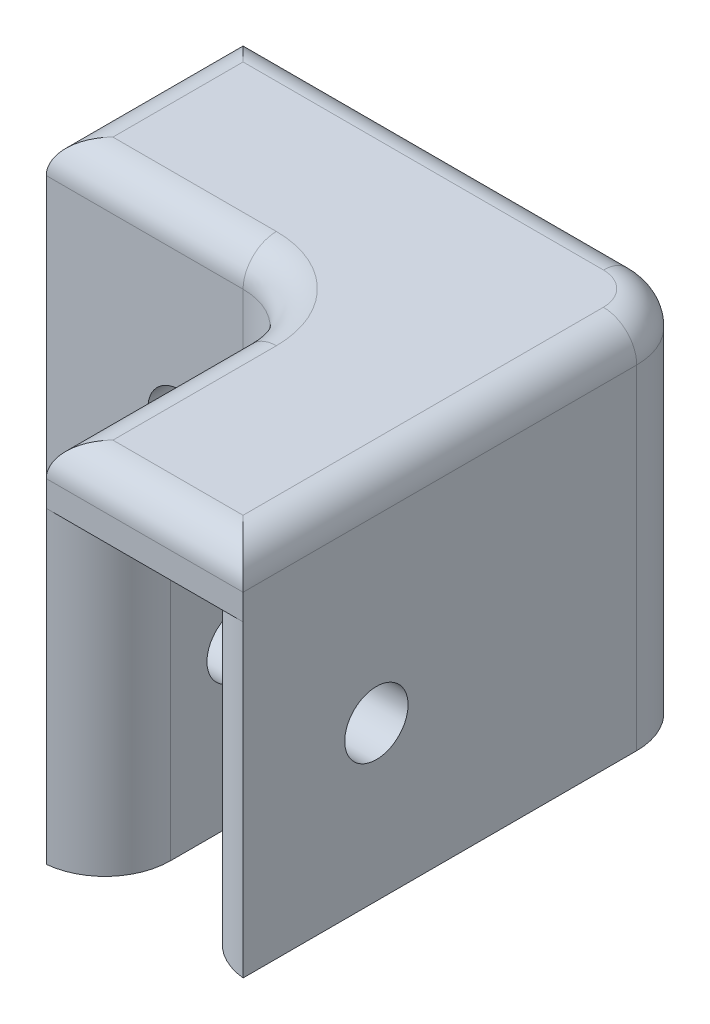
from build123d import *

# Parameters (mm, degrees)
BOSS_EXTRUDE1_DEPTH = 28
CUT_EXTRUDE1_DEPTH  = 23.5
FILLET1_R           = 5
FILLET3_R           = 5
FILLET4_R           = 5
SKETCH3_R           = 2.413
CUT_EXTRUDE2_DEPTH  = 57.868268832
SKETCH4_R           = 2.413
CUT_EXTRUDE3_DEPTH  = 57.868268832
FILLET5_R           = 2.54


with BuildPart() as part:
    # Sketch1 → Boss-Extrude1 (new body)
    with BuildSketch(Plane(origin=(0, 0, 0), x_dir=(1, 0, 0), z_dir=(0, 1, 0))):
        Polygon((0, 0), (-35, 0), (-35, -15), (-15, -15), (-15, -35), (0, -35), align=None)
    extrude(amount=BOSS_EXTRUDE1_DEPTH)

    # Sketch2 → Cut-Extrude1 (cut)
    with BuildSketch(Plane.XZ):
        Polygon((-35, 4.5), (-4.5, 4.5), (-4.5, 35), (-10.5, 35), (-10.5, 10.5), (-35, 10.5), align=None)
    extrude(amount=-CUT_EXTRUDE1_DEPTH, mode=Mode.SUBTRACT)

    # Fillet1
    fillet1_edges = [part.edges().sort_by_distance(p)[0] for p in [
        (-10.5, 11.75, 10.5),
        (-4.5, 11.75, 4.5),
    ]]
    fillet(fillet1_edges, radius=FILLET1_R)

    # Fillet3
    # the kernel refuses this fillet: 5 mm, written as the material it takes off along each edge
    with BuildSketch(Plane(origin=(-4.5, -12.437342964, 35), x_dir=(0, 0, -1), z_dir=(0, 1, 0))) as fillet3_piece_1:
        with BuildLine():
            CenterArc((4.974937186, -5), FILLET3_R, 90, 84.260829523)
            Line((0, -4.5), (0, 0))
            Line((0, 0), (4.974937186, 0))
        make_face()
    extrude(amount=35.937342964, mode=Mode.SUBTRACT)
    with BuildSketch(Plane(origin=(-10.5, -12.437342964, 35), x_dir=(-1, 0, 0), z_dir=(0, 1, 0))) as fillet3_piece_2:
        with BuildLine():
            CenterArc((5, -4.974937186), FILLET3_R, 95.739170477, 84.260829523)
            Line((0, -4.974937186), (0, 0))
            Line((0, 0), (4.5, 0))
        make_face()
    extrude(amount=35.937342964, mode=Mode.SUBTRACT)
    with BuildSketch(Plane(origin=(-35, -12.437342964, 10.5), x_dir=(0, 0, 1), z_dir=(0, 1, 0))) as fillet3_piece_3:
        with BuildLine():
            CenterArc((5, 4.974937186), FILLET3_R, 180, 84.260829523)
            Line((0, 4.974937186), (0, 0))
            Line((0, 0), (4.5, 0))
        make_face()
    extrude(amount=35.937342964, mode=Mode.SUBTRACT)
    with BuildSketch(Plane(origin=(-35, -12.437342964, 4.5), x_dir=(1, 0, 0), z_dir=(0, 1, 0))) as fillet3_piece_4:
        with BuildLine():
            CenterArc((4.974937186, 5), FILLET3_R, 185.739170477, 84.260829523)
            Line((0, 4.5), (0, 0))
            Line((0, 0), (4.974937186, 0))
        make_face()
    extrude(amount=35.937342964, mode=Mode.SUBTRACT)

    # Fillet4
    fillet4_edges = [part.edges().sort_by_distance(p)[0] for p in [
        (-15, 14, 15),
        (0, 14, 0),
    ]]
    fillet(fillet4_edges, radius=FILLET4_R)

    # Sketch3 → Cut-Extrude2 (cut, through all)
    with BuildSketch(Plane(origin=(0, 0, 0), x_dir=(0, 0, -1), z_dir=(1, 0, 0))):
        with Locations((-24.84, 11.75)):
            Circle(SKETCH3_R)
    extrude(amount=-CUT_EXTRUDE2_DEPTH, mode=Mode.SUBTRACT)

    # Sketch4 → Cut-Extrude3 (cut, through all)
    with BuildSketch(Plane(origin=(0, 0, 0), x_dir=(-1, 0, 0), z_dir=(0, 0, -1))):
        with Locations((24.84, 14)):
            Circle(SKETCH4_R)
    extrude(amount=-CUT_EXTRUDE3_DEPTH, mode=Mode.SUBTRACT)

    # Fillet5
    fillet5_edges = [part.edges().sort_by_distance(p)[0] for p in [
        (-20, 28, 0),
        (-15, 28, 27.5),
        (-1.464466094, 28, 1.464466094),
        (-16.464466094, 28, 16.464466094),
        (-35, 28, 7.5),
        (-27.5, 28, 15),
        (-7.5, 28, 35),
        (0, 28, 20),
    ]]
    fillet(fillet5_edges, radius=FILLET5_R)


solid = part.part
